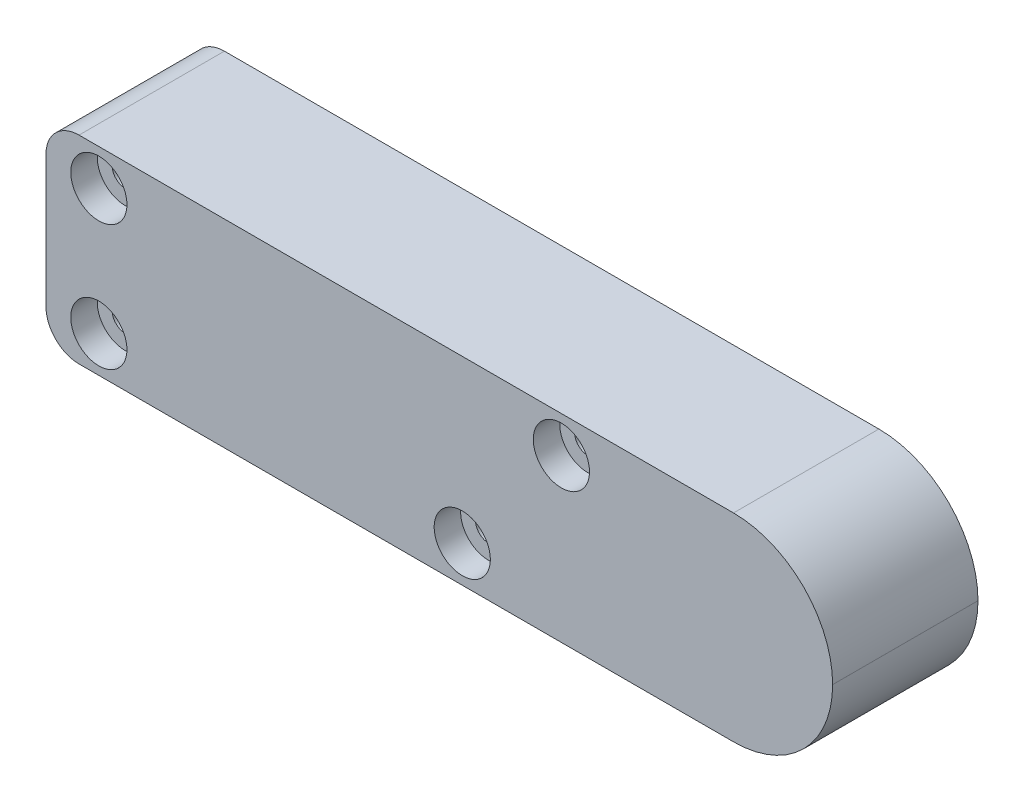
from build123d import *

# Parameters (mm, degrees)
SKETCH_1_W          = 140
SKETCH_1_H          = 40
EXTRUDE_1_DEPTH     = 35
CUT_EXTRUDE_START   = -25
CUT_EXTRUDE_1_DEPTH = 25
SKETCH_3_W          = 20.946458808
SKETCH_3_H          = 40
CUT_EXTRUDE_2_DEPTH = 50
SKETCH_4_W          = 119.053541192
SKETCH_4_H          = 40
CUT_EXTRUDE_3_DEPTH = 16
SKETCH_5_W          = 119.053541192
SKETCH_5_H          = 7.566301572
CUT_EXTRUDE_4_DEPTH = 33
FILLET_1_R          = 5
SKETCH_6_W          = 119.053541192
SKETCH_6_H          = 32.433698428
EXTRUDE_2_DEPTH     = 3
SKETCH_7_W          = 119.053541192
SKETCH_7_H          = 2.43
CUT_EXTRUDE_5_DEPTH = 25
FILLET_2_R          = 15
SKETCH_8_R          = 2
CUT_EXTRUDE_6_DEPTH = 25
SKETCH_9_R          = 4.25
CUT_EXTRUDE_7_DEPTH = 4
FILLET_3_R          = 5


# Read off the part's stored shape, not the designer's step: 切除-拉伸1
with BuildPart() as part:
    # 草图1 → 凸台-拉伸1 (new body)
    with BuildSketch(Plane.XY):
        Rectangle(SKETCH_1_W, SKETCH_1_H)
    extrude(amount=EXTRUDE_1_DEPTH)

    # 切除-拉伸1 outline → 切除-拉伸1 (cut)
    with BuildSketch(Plane.XY.offset(35).offset(CUT_EXTRUDE_START)):
        with BuildLine():
            ThreePointArc((-65, 0.939701666), (-63.90540849, -0.926084141), (-61.742713718, -0.880933602))
            add(Edge.make_bspline(
                [(-61.742713718, -0.880933602), (-32.663633491, 12.545599653), (-3.21353823, 2.722880029)],
                knots=[0, 0, 0, 1, 1, 1], degree=2))
            add(Edge.make_bspline(
                [(-3.21353823, 2.722880029), (7.778991577, -3.486736981), (19.521763095, -12.075038105), (32.974458778, -10.310789055)],
                knots=[0, 0, 0, 0, 1, 1, 1, 1], degree=3))
            add(Edge.make_bspline(
                [(-1.265226953, 9.621082728), (5.319961167, 7.826511536), (19.072649984, 4.273931772), (30.116773563, 18.680420492), (50.141031873, 7.903163107), (40.152384038, -8.700046956), (32.974458778, -10.310789055)],
                knots=[0, 0, 0, 0, 0.327114299, 0.472643013, 0.672292196, 1, 1, 1, 1], degree=3))
            add(Edge.make_bspline(
                [(-62.225486261, 6.840593766), (-61.950401652, 6.977325912), (-60.645663364, 7.609645854), (-56.787258029, 9.270913685), (-50.206414035, 11.371256832), (-41.494158434, 13.209404155), (-32.600965324, 14.299233241), (-23.90205386, 14.645800276), (-15.41426271, 14.074279585), (-7.837972032, 12.457111584), (-3.215945129, 10.610499943), (-1.265226953, 9.621082728)],
                knots=[0.117371432, 0.117371432, 0.117371432, 0.117371432, 0.12919832, 0.172962492, 0.2758611, 0.378759707, 0.481658315, 0.584556923, 0.687455531, 0.790354139, 0.871867558, 0.871867558, 0.871867558, 0.871867558], degree=3))
            ThreePointArc((-62.225486261, 6.840593766), (-64.250143015, 4.996865242), (-65, 2.363182583))
            Line((-65, 2.363182583), (-65, 0.939701666))
        make_face()
    extrude(amount=CUT_EXTRUDE_1_DEPTH, mode=Mode.SUBTRACT)

    # 草图3 → 切除-拉伸2 (cut)
    with BuildSketch(Plane.XY.offset(35)):
        with Locations((59.526770596, 0)):
            Rectangle(SKETCH_3_W, SKETCH_3_H)
    extrude(amount=-CUT_EXTRUDE_2_DEPTH, mode=Mode.SUBTRACT)

    # 草图4 → 切除-拉伸3 (cut)
    with BuildSketch(Plane(origin=(0, 0, 0), x_dir=(-1, 0, 0), z_dir=(0, 0, -1))):
        with Locations((10.473229404, 0)):
            Rectangle(SKETCH_4_W, SKETCH_4_H)
    extrude(amount=-CUT_EXTRUDE_3_DEPTH, mode=Mode.SUBTRACT)

    # 草图5 → 切除-拉伸4 (cut)
    with BuildSketch(Plane.XY.offset(35)):
        with Locations((-10.473229404, -16.216849214)):
            Rectangle(SKETCH_5_W, SKETCH_5_H)
    extrude(amount=-CUT_EXTRUDE_4_DEPTH, mode=Mode.SUBTRACT)

    # 圆角1
    fillet_1_edges = [part.edges().sort_by_distance(p)[0] for p in [
        (-3.21353823, 2.722880029, 25.5),
        (-1.265226953, 9.621082728, 25.5),
    ]]
    fillet(fillet_1_edges, radius=FILLET_1_R)

    # 草图6 → 凸台-拉伸2 (add)
    with BuildSketch(Plane.XY.offset(35)):
        with Locations((-10.473229404, 3.783150786)):
            Rectangle(SKETCH_6_W, SKETCH_6_H)
    extrude(amount=EXTRUDE_2_DEPTH)

    # 草图7 → 切除-拉伸5 (cut)
    with BuildSketch(Plane(origin=(0, 0, 16), x_dir=(-1, 0, 0), z_dir=(0, 0, -1))):
        with Locations((10.473229404, 18.785)):
            Rectangle(SKETCH_7_W, SKETCH_7_H)
    extrude(amount=-CUT_EXTRUDE_5_DEPTH, mode=Mode.SUBTRACT)

    # 圆角2
    fillet_2_edges = [part.edges().sort_by_distance(p)[0] for p in [
        (49.053541192, 17.57, 27),
        (49.053541192, -12.433698428, 27),
    ]]
    fillet(fillet_2_edges, radius=FILLET_2_R)

    # 草图8 → 切除-拉伸6 (cut)
    with BuildSketch(Plane(origin=(0, 0, 16), x_dir=(-1, 0, 0), z_dir=(0, 0, -1))):
        with Locations((62, 12.07)):
            Circle(SKETCH_8_R)
        with Locations((-8, 12.07)):
            Circle(SKETCH_8_R)
        with Locations((62, -6.933698428)):
            Circle(SKETCH_8_R)
        with Locations((7, -6.933698428)):
            Circle(SKETCH_8_R)
    extrude(amount=-CUT_EXTRUDE_6_DEPTH, mode=Mode.SUBTRACT)

    # 草图9 → 切除-拉伸7 (cut)
    with BuildSketch(Plane.XY.offset(38)):
        with Locations((-62, 12.07)):
            Circle(SKETCH_9_R)
        with Locations((-62, -6.933698428)):
            Circle(SKETCH_9_R)
        with Locations((8, 12.07)):
            Circle(SKETCH_9_R)
        with Locations((-7, -6.933698428)):
            Circle(SKETCH_9_R)
    extrude(amount=-CUT_EXTRUDE_7_DEPTH, mode=Mode.SUBTRACT)

    # 圆角3
    fillet_3_edges = [part.edges().sort_by_distance(p)[0] for p in [
        (-70, 17.57, 27),
        (-70, -12.433698428, 27),
    ]]
    fillet(fillet_3_edges, radius=FILLET_3_R)


solid = part.part
